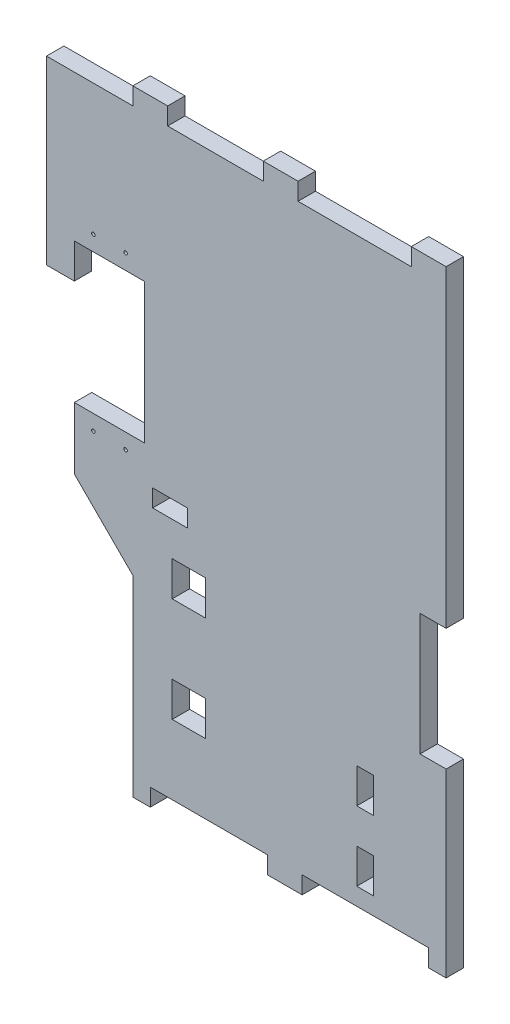
from build123d import *

# Parameters (mm, degrees)
ESQUISSE1_W             = 4.807532778
ESQUISSE1_H             = 10
ESQUISSE1_W_2           = 9.57980661
BOSS_EXTRU_1_DEPTH      = 5
BOSS_EXTRU_2_DEPTH      = 5
ESQUISSE3_W             = 20.2
ESQUISSE3_H             = 40.2
ENL_V_MAT_EXTRU_1_DEPTH = 5
ESQUISSE4_W             = 8
ESQUISSE4_H             = 52
ESQUISSE4_W_2           = 10
ESQUISSE4_H_2           = 5
ESQUISSE4_W_3           = 5
BOSS_EXTRU_3_DEPTH      = 5
ESQUISSE5_R             = 0.5
ENL_V_MAT_EXTRU_2_DEPTH = 5
ESQUISSE6_W             = 10
ESQUISSE6_H             = 4.997669143
ENL_V_MAT_EXTRU_3_DEPTH = 10


with BuildPart() as part:
    # Esquisse1 → Boss.-Extru.1 (new body)
    with BuildSketch(Plane.XY):
        Polygon((90, 82), (90, 167), (90, 172), (80, 172), (80, 167), (10, 167), (10, 172), (0, 172), (0, 167), (0, 0), (0, -5), (5, -5), (5, 0), (90, 0), (90, 47), (82.5, 47), (82.5, 82), align=None)
        with Locations((66.738521132, 30)):
            Rectangle(ESQUISSE1_W, ESQUISSE1_H, mode=Mode.SUBTRACT)
        with Locations((66.738521132, 10)):
            Rectangle(ESQUISSE1_W, ESQUISSE1_H, mode=Mode.SUBTRACT)
        with Locations((16.093272864, 25)):
            Rectangle(ESQUISSE1_W_2, ESQUISSE1_H, mode=Mode.SUBTRACT)
        with Locations((16.093272864, 55)):
            Rectangle(ESQUISSE1_W_2, ESQUISSE1_H, mode=Mode.SUBTRACT)
    extrude(amount=BOSS_EXTRU_1_DEPTH)

    # Esquisse2 → Boss.-Extru.2 (add)
    with BuildSketch(Plane.XY.offset(5)):
        Polygon((0, 167), (-16.814476947, 167), (-16.814476947, 67), (0, 50.185523053), align=None)
    extrude(amount=-BOSS_EXTRU_2_DEPTH)

    # Esquisse3 → Enlèv. mat.-Extru.1 (cut)
    with BuildSketch(Plane.XY.offset(5)):
        with Locations((-6.714476947, 104.9)):
            Rectangle(ESQUISSE3_W, ESQUISSE3_H)
    extrude(amount=-ENL_V_MAT_EXTRU_1_DEPTH, mode=Mode.SUBTRACT)

    # Esquisse4 → Boss.-Extru.3 (add)
    with BuildSketch(Plane.XY.offset(5)):
        with Locations((-20.814476947, 141)):
            Rectangle(ESQUISSE4_W, ESQUISSE4_H)
        with Locations((43.633734486, -2.5)):
            Rectangle(ESQUISSE4_W_2, ESQUISSE4_H_2)
        with Locations((87.5, -2.5)):
            Rectangle(ESQUISSE4_W_3, ESQUISSE4_H_2)
        with Locations((42.466362442, 169.5)):
            Rectangle(ESQUISSE4_W_2, ESQUISSE4_H_2)
    extrude(amount=-BOSS_EXTRU_3_DEPTH)

    # Esquisse5 → Enlèv. mat.-Extru.2 (cut)
    with BuildSketch(Plane.XY.offset(5)):
        with Locations((-11.339476947, 129.4)):
            Circle(ESQUISSE5_R)
        with Locations((-2.089476947, 129.4)):
            Circle(ESQUISSE5_R)
        with Locations((-11.339476947, 80.4)):
            Circle(ESQUISSE5_R)
        with Locations((-2.089476947, 80.4)):
            Circle(ESQUISSE5_R)
    extrude(amount=-ENL_V_MAT_EXTRU_2_DEPTH, mode=Mode.SUBTRACT)

    # Esquisse6 → Enlèv. mat.-Extru.3 (cut)
    with BuildSketch(Plane.XY.offset(5)):
        with Locations((10.685768017, 72.301165429)):
            Rectangle(ESQUISSE6_W, ESQUISSE6_H)
    extrude(amount=-ENL_V_MAT_EXTRU_3_DEPTH, mode=Mode.SUBTRACT)


solid = part.part
